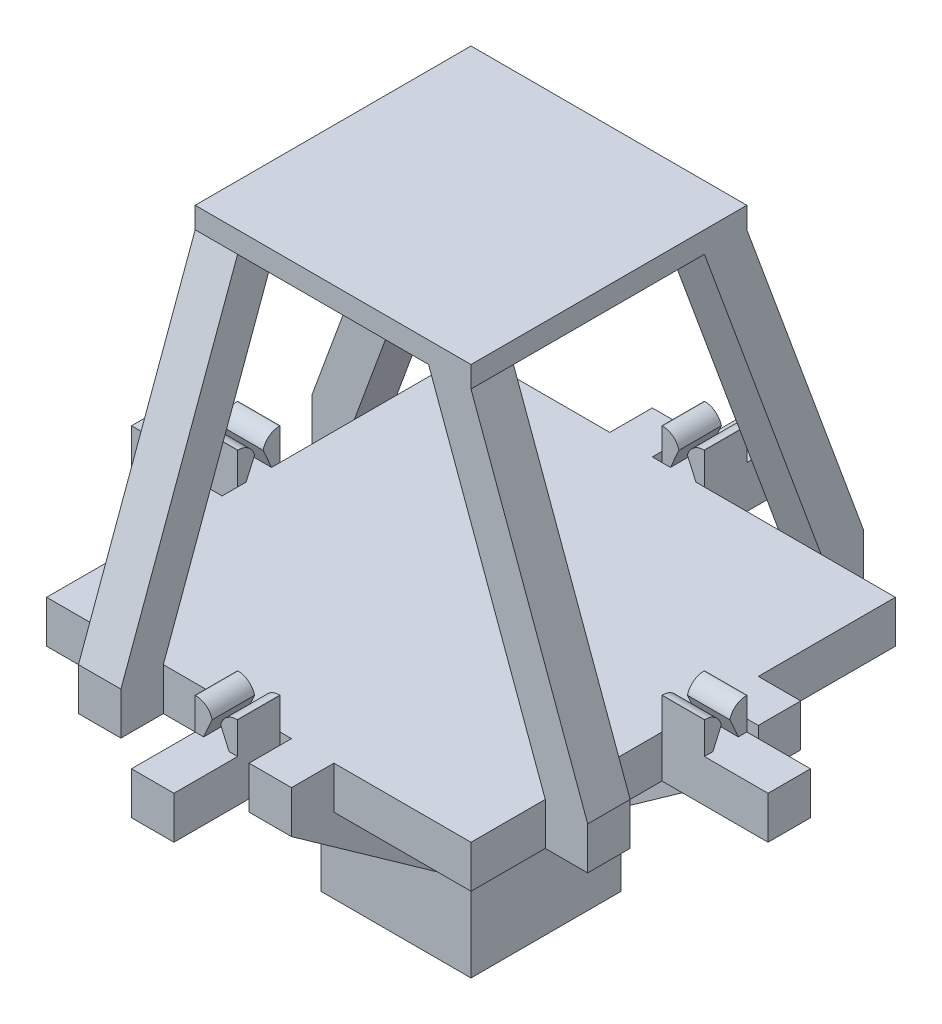
from build123d import *

# Parameters (mm, degrees)
SKETCH2_W            = 100
SKETCH2_H            = 100
BOSS_EXTRUDE1_DEPTH  = 5
SKETCH3_W            = 100
SKETCH3_H            = 100
BOSS_EXTRUDE2_DEPTH  = 5
SKETCH8_R            = 5
BOSS_EXTRUDE7_DEPTH  = 30
BOSS_EXTRUDE21_DEPTH = 10
FILLET14_R           = 4
FILLET13_R           = 4
SKETCH24_W           = 10
SKETCH24_H           = 10
BOSS_EXTRUDE22_DEPTH = 15
BOSS_EXTRUDE25_DEPTH = 10
SKETCH26_W           = 10
SKETCH26_H           = 10
BOSS_EXTRUDE26_DEPTH = 15
FILLET18_R           = 4
FILLET17_R           = 4
BOSS_EXTRUDE23_DEPTH = 10
SKETCH25_W           = 10
SKETCH25_H           = 10
BOSS_EXTRUDE24_DEPTH = 15
FILLET15_R           = 4
FILLET16_R           = 4
BOSS_EXTRUDE10_DEPTH = 10
FILLET19_R           = 4
SKETCH27_W           = 10
SKETCH27_H           = 10
BOSS_EXTRUDE27_DEPTH = 15
FILLET20_R           = 4
SKETCH33_W           = 65
SKETCH33_H           = 65
BOSS_EXTRUDE29_DEPTH = 5
BOSS_EXTRUDE28_DEPTH = 10
BOSS_EXTRUDE32_DEPTH = 10
BOSS_EXTRUDE34_DEPTH = 10
BOSS_EXTRUDE35_DEPTH = 10
BOSS_EXTRUDE31_DEPTH = 10
BOSS_EXTRUDE33_DEPTH = 10
BOSS_EXTRUDE36_DEPTH = 10
BOSS_EXTRUDE37_DEPTH = 10
SKETCH46_W           = 28.272110448
SKETCH46_H           = 20.427935106
CUT_EXTRUDE1_DEPTH   = 30
SKETCH47_W           = 35.4
SKETCH47_H           = 35.4
BOSS_EXTRUDE38_DEPTH = 20
SKETCH49_W           = 25.4
SKETCH49_H           = 25.4
CUT_EXTRUDE2_DEPTH   = 12.7
SKETCH51_W           = 10
SKETCH51_H           = 10
BOSS_EXTRUDE39_DEPTH = 10
BOSS_EXTRUDE40_DEPTH = 10
SKETCH54_W           = 10
SKETCH54_H           = 10
BOSS_EXTRUDE41_DEPTH = 10
BOSS_EXTRUDE42_DEPTH = 10
SKETCH56_W           = 10
SKETCH56_H           = 10
BOSS_EXTRUDE43_DEPTH = 10
BOSS_EXTRUDE47_DEPTH = 10
SKETCH59_W           = 10
SKETCH59_H           = 10
BOSS_EXTRUDE48_DEPTH = 10
BOSS_EXTRUDE52_DEPTH = 10


with BuildPart() as part:
    # Sketch2 → Boss-Extrude1 (new body)
    with BuildSketch(Plane(origin=(0, 0, 0), x_dir=(1, 0, 0), z_dir=(0, 1, 0))):
        Rectangle(SKETCH2_W, SKETCH2_H)
    extrude(amount=BOSS_EXTRUDE1_DEPTH)

    # Sketch3 → Boss-Extrude2 (add)
    with BuildSketch(Plane.XZ):
        Rectangle(SKETCH3_W, SKETCH3_H)
    extrude(amount=BOSS_EXTRUDE2_DEPTH)

    # Sketch8 → Boss-Extrude7 (add)
    with BuildSketch(Plane.XZ.offset(5)):
        with Locations(Location((0, 0, 0), (0, 0, 90))):
            Circle(SKETCH8_R)
    extrude(amount=BOSS_EXTRUDE7_DEPTH)

    # Sketch11 → Boss-Extrude21 (add)
    with BuildSketch(Plane(origin=(50, 0, 0), x_dir=(0, 0, -1), z_dir=(1, 0, 0))):
        Polygon((5, -5), (5, 12.5), (1, 12.5), (1, 9.5), (3, 5), (-3, 5), (-1, 9.5), (-1, 12.5), (-5, 12.5), (-5, -5), align=None)
    extrude(amount=BOSS_EXTRUDE21_DEPTH)

    # Fillet14
    # the kernel refuses this fillet: 4 mm, written as the material it takes off along each edge
    with BuildSketch(Plane(origin=(40.317541634, 12.5, -1), x_dir=(0, -1, 0), z_dir=(1, 0, 0))) as fillet14_piece_1:
        with BuildLine():
            CenterArc((4, 3.872983346), FILLET14_R, 180, 75.522487814)
            Line((0, 3.872983346), (-0.08, 3.872983346))
            Line((-0.08, 3.872983346), (-0.08, 0))
            Line((-0.08, 0), (0, -0.08))
            ThreePointArc((0, -0.08), (1.5, -0.08), (2.98, -0.077459667))
            Line((2.98, -0.077459667), (3, 0))
        make_face()
    extrude(amount=29.364916731, mode=Mode.SUBTRACT)

    # Fillet13
    # the kernel refuses this fillet: 4 mm, written as the material it takes off along each edge
    with BuildSketch(Plane(origin=(40.317541634, 12.5, 1), x_dir=(0, 0, 1), z_dir=(1, 0, 0))) as fillet13_piece_1:
        with BuildLine():
            CenterArc((3.872983346, 4), FILLET13_R, 194.477512186, 75.522487814)
            Line((0, 3), (-0.077459667, 2.98))
            ThreePointArc((-0.077459667, 2.98), (-0.08, 1.5), (-0.08, 0))
            Line((-0.08, 0), (0, -0.08))
            Line((0, -0.08), (3.872983346, -0.08))
            Line((3.872983346, -0.08), (3.872983346, 0))
        make_face()
    extrude(amount=29.364916731, mode=Mode.SUBTRACT)

    # Sketch24 → Boss-Extrude22 (add)
    with BuildSketch(Plane(origin=(60, 0, 0), x_dir=(0, 0, -1), z_dir=(1, 0, 0))):
        Rectangle(SKETCH24_W, SKETCH24_H)
    extrude(amount=BOSS_EXTRUDE22_DEPTH)

    # Sketch13 → Boss-Extrude25 (add)
    with BuildSketch(Plane.ZY.offset(50)):
        Polygon((-5, 12.5), (-5, -5), (5, -5), (5, 12.5), (1, 12.5), (1, 9.5), (3, 5), (-3, 5), (-1, 9.5), (-1, 12.5), align=None)
    extrude(amount=BOSS_EXTRUDE25_DEPTH)

    # Sketch26 → Boss-Extrude26 (add)
    with BuildSketch(Plane.ZY.offset(60)):
        Rectangle(SKETCH26_W, SKETCH26_H)
    extrude(amount=BOSS_EXTRUDE26_DEPTH)

    # Fillet18
    # the kernel refuses this fillet: 4 mm, written as the material it takes off along each edge
    with BuildSketch(Plane(origin=(-40.317541634, 12.5, 1), x_dir=(0, -1, 0), z_dir=(-1, 0, 0))) as fillet18_piece_1:
        with BuildLine():
            CenterArc((4, 3.872983346), FILLET18_R, 180, 75.522487814)
            Line((0, 3.872983346), (-0.08, 3.872983346))
            Line((-0.08, 3.872983346), (-0.08, 0))
            Line((-0.08, 0), (0, -0.08))
            ThreePointArc((0, -0.08), (1.5, -0.08), (2.98, -0.077459667))
            Line((2.98, -0.077459667), (3, 0))
        make_face()
    extrude(amount=29.364916731, mode=Mode.SUBTRACT)

    # Fillet17
    # the kernel refuses this fillet: 4 mm, written as the material it takes off along each edge
    with BuildSketch(Plane(origin=(-40.317541634, 12.5, -1), x_dir=(0, 0, -1), z_dir=(-1, 0, 0))) as fillet17_piece_1:
        with BuildLine():
            CenterArc((3.872983346, 4), FILLET17_R, 194.477512186, 75.522487814)
            Line((0, 3), (-0.077459667, 2.98))
            ThreePointArc((-0.077459667, 2.98), (-0.08, 1.5), (-0.08, 0))
            Line((-0.08, 0), (0, -0.08))
            Line((0, -0.08), (3.872983346, -0.08))
            Line((3.872983346, -0.08), (3.872983346, 0))
        make_face()
    extrude(amount=29.364916731, mode=Mode.SUBTRACT)

    # Sketch14 → Boss-Extrude23 (add)
    with BuildSketch(Plane(origin=(0, 0, -50), x_dir=(-1, 0, 0), z_dir=(0, 0, -1))):
        Polygon((-5, 12.5), (-1, 12.5), (-1, 9.5), (-3, 5), (3, 5), (1, 9.5), (1, 12.5), (5, 12.5), (5, -5), (-5, -5), align=None)
    extrude(amount=BOSS_EXTRUDE23_DEPTH)

    # Sketch25 → Boss-Extrude24 (add)
    with BuildSketch(Plane(origin=(0, 0, -60), x_dir=(-1, 0, 0), z_dir=(0, 0, -1))):
        Rectangle(SKETCH25_W, SKETCH25_H)
    extrude(amount=BOSS_EXTRUDE24_DEPTH)

    # Fillet15
    # the kernel refuses this fillet: 4 mm, written as the material it takes off along each edge
    with BuildSketch(Plane(origin=(-1, 12.5, -40.317541634), x_dir=(0, -1, 0), z_dir=(0, 0, -1))) as fillet15_piece_1:
        with BuildLine():
            CenterArc((4, 3.872983346), FILLET15_R, 180, 75.522487814)
            Line((0, 3.872983346), (-0.08, 3.872983346))
            Line((-0.08, 3.872983346), (-0.08, 0))
            Line((-0.08, 0), (0, -0.08))
            ThreePointArc((0, -0.08), (1.5, -0.08), (2.98, -0.077459667))
            Line((2.98, -0.077459667), (3, 0))
        make_face()
    extrude(amount=29.364916731, mode=Mode.SUBTRACT)

    # Fillet16
    # the kernel refuses this fillet: 4 mm, written as the material it takes off along each edge
    with BuildSketch(Plane(origin=(1, 12.5, -40.317541634), x_dir=(0, -1, 0), z_dir=(0, 0, -1))) as fillet16_piece_1:
        with BuildLine():
            CenterArc((4, -3.872983346), FILLET16_R, 104.477512186, 75.522487814)
            Line((0, -3.872983346), (-0.08, -3.872983346))
            Line((-0.08, -3.872983346), (-0.08, 0))
            Line((-0.08, 0), (0, 0.08))
            ThreePointArc((0, 0.08), (1.5, 0.08), (2.98, 0.077459667))
            Line((2.98, 0.077459667), (3, 0))
        make_face()
    extrude(amount=29.364916731, mode=Mode.SUBTRACT)

    # Sketch12 → Boss-Extrude10 (add)
    with BuildSketch(Plane.XY.offset(50)):
        Polygon((-5, 12.5), (-5, -5), (5, -5), (5, 12.5), (1, 12.5), (1, 9.5), (3, 5), (-3, 5), (-1, 9.5), (-1, 12.5), align=None)
    extrude(amount=BOSS_EXTRUDE10_DEPTH)

    # Fillet19
    # the kernel refuses this fillet: 4 mm, written as the material it takes off along each edge
    with BuildSketch(Plane(origin=(-1, 12.5, 40.317541634), x_dir=(-1, 0, 0), z_dir=(0, 0, 1))) as fillet19_piece_1:
        with BuildLine():
            CenterArc((3.872983346, 4), FILLET19_R, 194.477512186, 75.522487814)
            Line((0, 3), (-0.077459667, 2.98))
            ThreePointArc((-0.077459667, 2.98), (-0.08, 1.5), (-0.08, 0))
            Line((-0.08, 0), (0, -0.08))
            Line((0, -0.08), (3.872983346, -0.08))
            Line((3.872983346, -0.08), (3.872983346, 0))
        make_face()
    extrude(amount=29.364916731, mode=Mode.SUBTRACT)

    # Sketch27 → Boss-Extrude27 (add)
    with BuildSketch(Plane.XY.offset(60)):
        Rectangle(SKETCH27_W, SKETCH27_H)
    extrude(amount=BOSS_EXTRUDE27_DEPTH)

    # Fillet20
    # the kernel refuses this fillet: 4 mm, written as the material it takes off along each edge
    with BuildSketch(Plane(origin=(1, 12.5, 40.317541634), x_dir=(1, 0, 0), z_dir=(0, 0, 1))) as fillet20_piece_1:
        with BuildLine():
            CenterArc((3.872983346, -4), FILLET20_R, 90, 75.522487814)
            Line((0, -3), (-0.077459667, -2.98))
            ThreePointArc((-0.077459667, -2.98), (-0.08, -1.5), (-0.08, 0))
            Line((-0.08, 0), (0, 0.08))
            Line((0, 0.08), (3.872983346, 0.08))
            Line((3.872983346, 0.08), (3.872983346, 0))
        make_face()
    extrude(amount=29.364916731, mode=Mode.SUBTRACT)

    # Sketch30 → Boss-Extrude28 (add)
    with BuildSketch(Plane.ZY.offset(50)):
        Polygon((-27.5, 5), (-22.5, 5), (-22.5, -5), (-32.5, -5), (-32.5, 5), align=None)
    extrude(amount=BOSS_EXTRUDE28_DEPTH)



with BuildPart() as body_2:
    # Sketch33 → Boss-Extrude29 (new body)
    with BuildSketch(Plane(origin=(0, 85, 0), x_dir=(1, 0, 0), z_dir=(0, 1, 0))):
        Rectangle(SKETCH33_W, SKETCH33_H)
    extrude(amount=-BOSS_EXTRUDE29_DEPTH)


with BuildPart() as part_1:
    add(part.part)

    add(body_2.part)  # Boss-Extrude32 merges body 2
    # Sketch40 → Boss-Extrude32 (add)
    with BuildSketch(Plane(origin=(0, 0, -32.5), x_dir=(-1, 0, 0), z_dir=(0, 0, -1))):
        Polygon((60, 5), (32.5, 80), (22.5, 80), (50, 5), align=None)
    extrude(amount=-BOSS_EXTRUDE32_DEPTH)

    # Sketch42 → Boss-Extrude34 (add)
    with BuildSketch(Plane(origin=(50, 0, 0), x_dir=(0, 0, -1), z_dir=(1, 0, 0))):
        Polygon((-27.5, 5), (-22.5, 5), (-22.5, -5), (-32.5, -5), (-32.5, 5), align=None)
    extrude(amount=BOSS_EXTRUDE34_DEPTH)

    # Sketch43 → Boss-Extrude35 (add)
    with BuildSketch(Plane.XY.offset(32.5)):
        Polygon((32.5, 80), (60, 5), (50, 5), (22.5, 80), align=None)
    extrude(amount=-BOSS_EXTRUDE35_DEPTH)

    # Sketch37 → Boss-Extrude31 (add)
    with BuildSketch(Plane.XY.offset(50)):
        Polygon((-27.5, 5), (-22.5, 5), (-22.5, -5), (-32.5, -5), (-32.5, 5), align=None)
    extrude(amount=BOSS_EXTRUDE31_DEPTH)

    # Sketch41 → Boss-Extrude33 (add)
    with BuildSketch(Plane.ZY.offset(32.5)):
        Polygon((60, 5), (32.5, 80), (22.5, 80), (50, 5), align=None)
    extrude(amount=-BOSS_EXTRUDE33_DEPTH)

    # Sketch44 → Boss-Extrude36 (add)
    with BuildSketch(Plane(origin=(0, 0, -50), x_dir=(-1, 0, 0), z_dir=(0, 0, -1))):
        Polygon((-27.5, 5), (-22.5, 5), (-22.5, -5), (-32.5, -5), (-32.5, 5), align=None)
    extrude(amount=BOSS_EXTRUDE36_DEPTH)

    # Sketch45 → Boss-Extrude37 (add)
    with BuildSketch(Plane(origin=(32.5, 0, 0), x_dir=(0, 0, -1), z_dir=(1, 0, 0))):
        Polygon((32.5, 80), (60, 5), (50, 5), (22.5, 80), align=None)
    extrude(amount=-BOSS_EXTRUDE37_DEPTH)

    # Sketch46 → Cut-Extrude1 (cut)
    with BuildSketch(Plane.XZ.offset(5)):
        Rectangle(SKETCH46_W, SKETCH46_H)
    extrude(amount=CUT_EXTRUDE1_DEPTH, mode=Mode.SUBTRACT)

    # Sketch51 → Boss-Extrude39 (add)
    with BuildSketch(Plane.XY.offset(50)):
        with Locations((12.7, 0)):
            Rectangle(SKETCH51_W, SKETCH51_H)
    extrude(amount=BOSS_EXTRUDE39_DEPTH)



with BuildPart() as body_2_2:
    # Sketch47 → Boss-Extrude38 (new body)
    with BuildSketch(Plane(origin=(0, -55, 0), x_dir=(-1, 0, 0), z_dir=(0, -1, 0))):
        Rectangle(SKETCH47_W, SKETCH47_H)
    extrude(amount=-BOSS_EXTRUDE38_DEPTH)

    # Sketch49 → Cut-Extrude2 (cut)
    with BuildSketch(Plane.XZ.offset(55)):
        Rectangle(SKETCH49_W, SKETCH49_H)
    extrude(amount=-CUT_EXTRUDE2_DEPTH, mode=Mode.SUBTRACT)


with BuildPart() as part_2:
    add(part_1.part)

    add(body_2_2.part)  # Boss-Extrude40 merges body 2 2
    # Sketch52 → Boss-Extrude40 (add)
    with BuildSketch(Plane(origin=(17.7, 0, 0), x_dir=(0, 0, -1), z_dir=(1, 0, 0))):
        Polygon((-60, -5), (-17.7, -35), (-7.7, -35), (-50, -5), align=None)
    extrude(amount=-BOSS_EXTRUDE40_DEPTH)

    # Sketch54 → Boss-Extrude41 (add)
    with BuildSketch(Plane(origin=(50, 0, 0), x_dir=(0, 0, -1), z_dir=(1, 0, 0))):
        with Locations((12.7, 0)):
            Rectangle(SKETCH54_W, SKETCH54_H)
    extrude(amount=BOSS_EXTRUDE41_DEPTH)

    # Sketch55 → Boss-Extrude42 (add)
    with BuildSketch(Plane(origin=(0, 0, -17.7), x_dir=(-1, 0, 0), z_dir=(0, 0, -1))):
        Polygon((-60, -5), (-17.7, -35), (-7.7, -35), (-50, -5), align=None)
    extrude(amount=-BOSS_EXTRUDE42_DEPTH)

    # Sketch56 → Boss-Extrude43 (add)
    with BuildSketch(Plane(origin=(0, 0, -50), x_dir=(-1, 0, 0), z_dir=(0, 0, -1))):
        with Locations((12.28306994, 0)):
            Rectangle(SKETCH56_W, SKETCH56_H)
    extrude(amount=BOSS_EXTRUDE43_DEPTH)

    # Sketch58 → Boss-Extrude47 (add)
    with BuildSketch(Plane.ZY.offset(17.28306994)):
        Polygon((-60, -5), (-17.7, -35), (-7.7, -35), (-50, -5), align=None)
    extrude(amount=-BOSS_EXTRUDE47_DEPTH)

    # Sketch59 → Boss-Extrude48 (add)
    with BuildSketch(Plane.ZY.offset(50)):
        with Locations((13.655595041, 0)):
            Rectangle(SKETCH59_W, SKETCH59_H)
    extrude(amount=BOSS_EXTRUDE48_DEPTH)

    # Sketch61 → Boss-Extrude52 (add)
    with BuildSketch(Plane.XY.offset(18.655595041)):
        Polygon((-60, -5), (-17.7, -35), (-7.7, -35), (-50, -5), align=None)
    extrude(amount=-BOSS_EXTRUDE52_DEPTH)


solid = part_2.part
